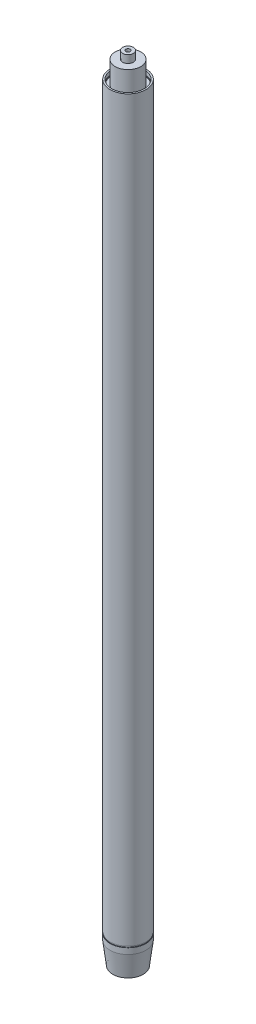
from build123d import *

# Parameters (mm, degrees)
SKETCH1_R           = 26.7208
SKETCH1_R_2         = 24.3332
BOSS_EXTRUDE1_DEPTH = 1111.25
SKETCH2_W           = 2.54
SKETCH2_H           = 2.032
SKETCH3_W           = 1.27
SKETCH3_H           = 2.032
SKETCH5_R           = 23.876
BOSS_EXTRUDE2_DEPTH = 12.7
SKETCH6_R           = 19.05
BOSS_EXTRUDE4_DEPTH = 33.02
SKETCH7_R           = 7.9375
SKETCH7_R_2         = 3.175
BOSS_EXTRUDE5_DEPTH = 11.43


with BuildPart() as part:
    # Sketch1 → Boss-Extrude1 (new body)
    with BuildSketch(Plane(origin=(0, 0, 0), x_dir=(1, 0, 0), z_dir=(0, 1, 0))):
        Circle(SKETCH1_R)
        Circle(SKETCH1_R_2, mode=Mode.SUBTRACT)
    extrude(amount=BOSS_EXTRUDE1_DEPTH)

    # Sketch2 → Cut-Revolve1 (revolve, cut)
    with BuildSketch(Plane.XY):
        with Locations((23.8252, 6.096)):
            Rectangle(SKETCH2_W, SKETCH2_H)
    cut_revolve1 = revolve(axis=Axis((0, 1111.25, 0), (0, -1, 0)), mode=Mode.SUBTRACT)

    # Mirror1: Cut-Revolve1 across plane
    add(cut_revolve1.mirror(Plane(origin=(0, 555.625, 0), x_dir=(0, 0, 1), z_dir=(0, -1, 0))), mode=Mode.SUBTRACT)

    # Sketch3 → Cut-Revolve2 (revolve, cut)
    with BuildSketch(Plane(origin=(0, 0, 0), x_dir=(0, 0, -1), z_dir=(1, 0, 0))):
        with Locations((26.5938, 9.779)):
            Rectangle(SKETCH3_W, SKETCH3_H)
    revolve(axis=Axis((0, 1111.25, 0), (0, -1, 0)), mode=Mode.SUBTRACT)

    # Sketch4 → Revolve2 (revolve)
    with BuildSketch(Plane.XY):
        Polygon((26.7208, 0), (22.6695, -33.147), (20.2819, -33.147), (24.3332, 0), align=None)
    revolve(axis=Axis((0, 1111.25, 0), (0, -1, 0)))


with BuildPart() as body_2:
    # Sketch5 → Boss-Extrude2 (new body)
    with BuildSketch(Plane(origin=(0, 1104.138, 0), x_dir=(1, 0, 0), z_dir=(0, 1, 0))):
        Circle(SKETCH5_R)
    extrude(amount=-BOSS_EXTRUDE2_DEPTH)

    # Sketch6 → Boss-Extrude4 (add)
    with BuildSketch(Plane(origin=(0, 1104.138, 0), x_dir=(1, 0, 0), z_dir=(0, 1, 0))):
        Circle(SKETCH6_R)
    extrude(amount=BOSS_EXTRUDE4_DEPTH)

    # Sketch7 → Boss-Extrude5 (add)
    with BuildSketch(Plane(origin=(0, 1137.158, 0), x_dir=(1, 0, 0), z_dir=(0, 1, 0))):
        Circle(SKETCH7_R)
        Circle(SKETCH7_R_2, mode=Mode.SUBTRACT)
    extrude(amount=BOSS_EXTRUDE5_DEPTH)


solid = Compound([part.part, body_2.part])
